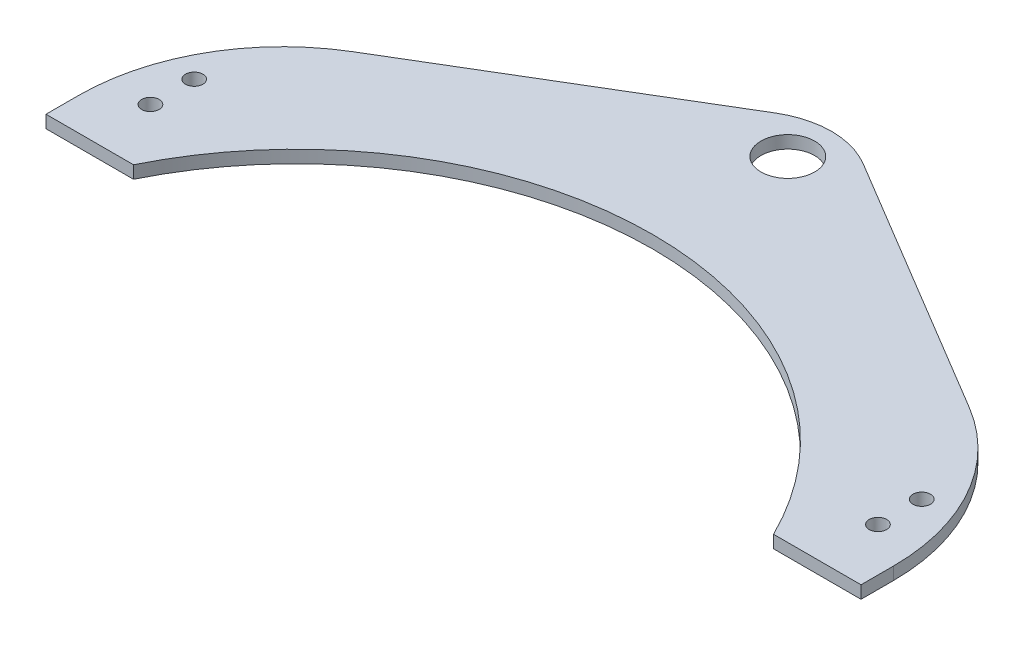
from build123d import *

# Parameters (mm, degrees)
SKETCH1_R           = 4.6
SKETCH1_R_2         = 1.5
BOSS_EXTRUDE2_DEPTH = 3.175
SKETCH2_W           = 235.965281387
SKETCH2_H           = 118.721671229
CUT_EXTRUDE1_DEPTH  = 1.016


with BuildPart() as part:
    # Sketch1 → Boss-Extrude2 (new body)
    with BuildSketch(Plane(origin=(0, 0, 0), x_dir=(1, 0, 0), z_dir=(0, 1, 0))):
        with BuildLine():
            Line((-7.5, 0), (0, 0))
            ThreePointArc((0, 0), (54.850000028, 34.150569312), (109.700000056, 0))
            Line((109.700000056, 0), (117.200000056, 0))
            Line((117.200000056, 0), (124.700000056, 0))
            Line((124.700000056, 0), (124.700000056, 5.554920326))
            ThreePointArc((124.700000056, 5.554920326), (120.146392707, 22.818094267), (107.670447225, 35.589284453))
            Line((107.670447225, 35.589284453), (62.40678526, 62.67187034))
            ThreePointArc((62.40678526, 62.67187034), (58.77003956, 64.238725538), (54.850000028, 64.799300745))
            ThreePointArc((54.850000028, 64.799300745), (50.929960496, 64.238725538), (47.293214796, 62.67187034))
            Line((47.293214796, 62.67187034), (2.029552831, 35.589284453))
            ThreePointArc((2.029552831, 35.589284453), (-10.446392651, 22.818094267), (-15, 5.554920326))
            Line((-15, 5.554920326), (-15, 0))
            Line((-15, 0), (-7.5, 0))
        make_face()
        with Locations((54.850000028, 57.3)):
            Circle(SKETCH1_R, mode=Mode.SUBTRACT)
        with BuildLine():
            ThreePointArc((-7.5, 8.9), (-9, 10.4), (-7.5, 11.9))
            ThreePointArc((-7.5, 11.9), (-6, 10.4), (-7.5, 8.9))
        make_face(mode=Mode.SUBTRACT)
        with Locations((-7.5, 17.9)):
            Circle(SKETCH1_R_2, mode=Mode.SUBTRACT)
        with Locations((117.200000056, 17.9)):
            Circle(SKETCH1_R_2, mode=Mode.SUBTRACT)
        with BuildLine():
            ThreePointArc((117.200000056, 8.9), (115.700000056, 10.4), (117.200000056, 11.9))
            ThreePointArc((117.200000056, 11.9), (118.700000056, 10.4), (117.200000056, 8.9))
        make_face(mode=Mode.SUBTRACT)
    extrude(amount=BOSS_EXTRUDE2_DEPTH)

    # Sketch2 → Cut-Extrude1 (cut)
    with BuildSketch(Plane(origin=(0, 3.175, 0), x_dir=(1, 0, 0), z_dir=(0, 1, 0))):
        with Locations((50.311488443, 30.817995662)):
            Rectangle(SKETCH2_W, SKETCH2_H)
    extrude(amount=-CUT_EXTRUDE1_DEPTH, mode=Mode.SUBTRACT)


solid = part.part
